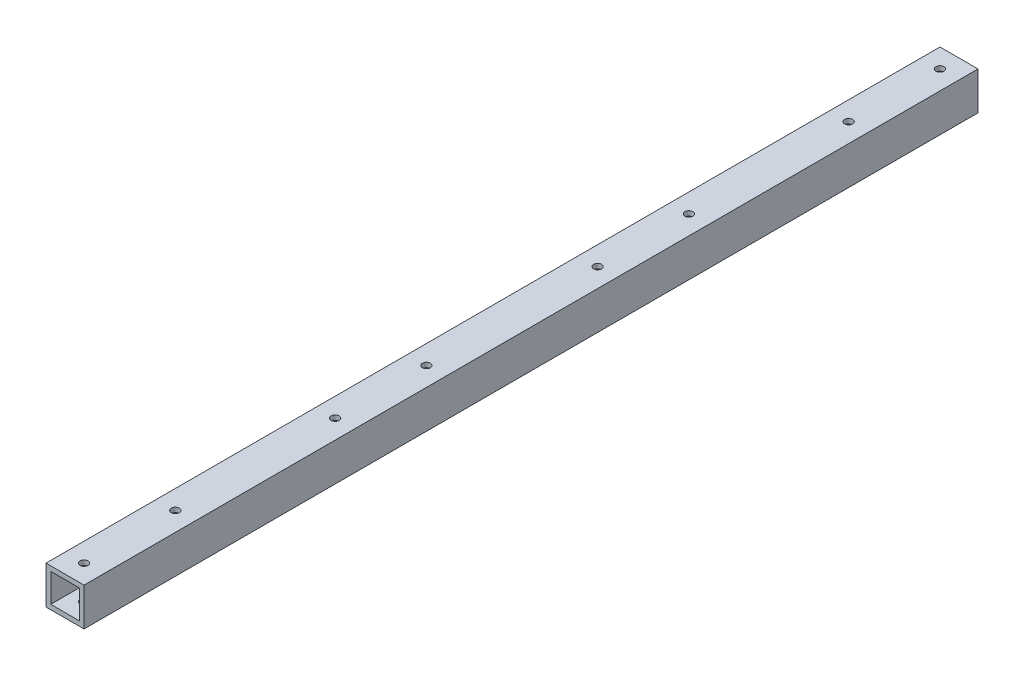
from build123d import *

# Parameters (mm, degrees)
SKETCH1_W           = 25.4
SKETCH1_H           = 25.4
SKETCH1_W_2         = 19.05
SKETCH1_H_2         = 19.05
BOSS_EXTRUDE1_DEPTH = 596.9
SKETCH2_R           = 2.667
CUT_EXTRUDE1_DEPTH  = 598.979874243
SKETCH4_R           = 2.667
CUT_EXTRUDE3_DEPTH  = 25.4


with BuildPart() as part:
    # Sketch1 → Boss-Extrude1 (new body)
    with BuildSketch(Plane.XY):
        with Locations((12.7, 12.7)):
            Rectangle(SKETCH1_W, SKETCH1_H)
        with Locations((12.7, 12.7)):
            Rectangle(SKETCH1_W_2, SKETCH1_H_2, mode=Mode.SUBTRACT)
    extrude(amount=BOSS_EXTRUDE1_DEPTH)

    # Sketch2 → Cut-Extrude1 (cut, through all)
    with BuildSketch(Plane(origin=(0, 25.4, 0), x_dir=(1, 0, 0), z_dir=(0, 1, 0))):
        with Locations((12.7, -584.2)):
            Circle(SKETCH2_R)
        with Locations((12.7, -12.7)):
            Circle(SKETCH2_R)
        with Locations((12.7, -523.24)):
            Circle(SKETCH2_R)
        with Locations((12.7, -73.66)):
            Circle(SKETCH2_R)
    extrude(amount=-CUT_EXTRUDE1_DEPTH, mode=Mode.SUBTRACT)

    # Sketch4 → Cut-Extrude3 (cut)
    with BuildSketch(Plane(origin=(0, 25.4, 0), x_dir=(1, 0, 0), z_dir=(0, 1, 0))):
        with Locations((12.7, -416.56)):
            Circle(SKETCH4_R)
        with Locations((12.7, -355.6)):
            Circle(SKETCH4_R)
        with Locations((12.7, -180.34)):
            Circle(SKETCH4_R)
        with Locations((12.7, -241.3)):
            Circle(SKETCH4_R)
    extrude(amount=-CUT_EXTRUDE3_DEPTH, mode=Mode.SUBTRACT)


solid = part.part
